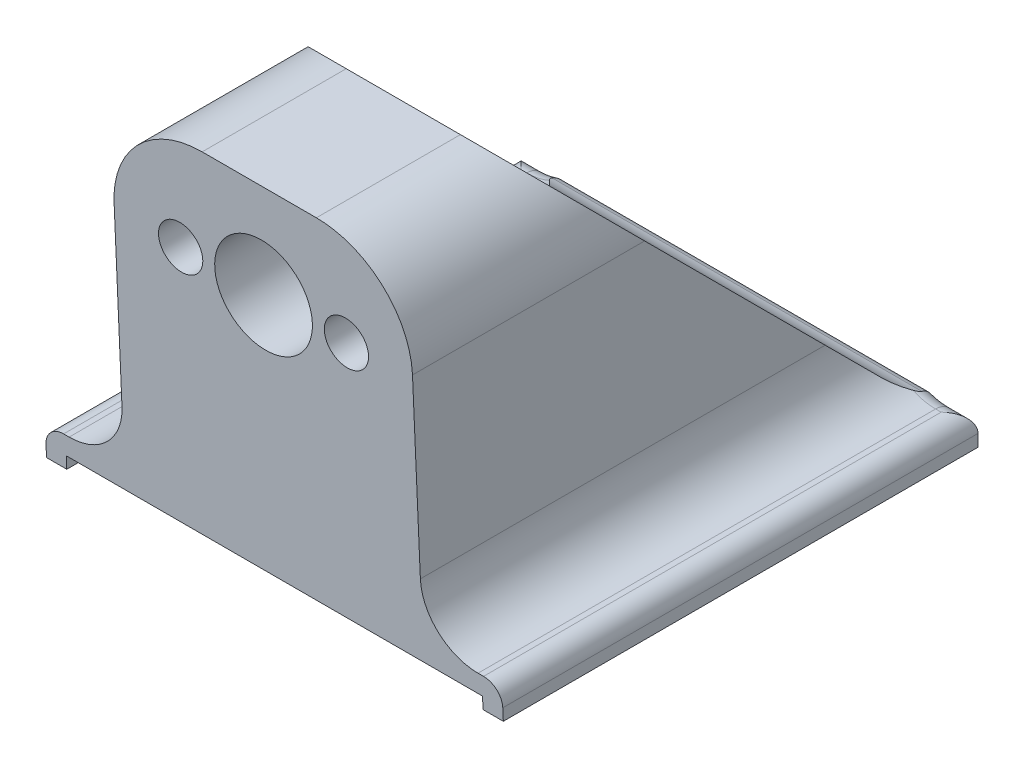
from build123d import *

# Parameters (mm, degrees)
SKETCH1_W             = 24.8
SKETCH1_H             = 25.8
BOSS_EXTRUDE1_DEPTH   = 1
SKETCH3_W             = 16.2
SKETCH3_H             = 7
BOSS_EXTRUDE3_DEPTH   = 17.8
DRAFT2_ANGLE          = 45
TOP_FILLET_R          = 5
SKETCH4_R             = 2.65
HOLE_BOLT_DEPTH       = 4
SKETCH5_R             = 4.5
HOLE_BOLT_CAP_DEPTH   = 20
SKETCH6_R             = 1.2
HOLES_DOWEL_PIN_DEPTH = 2.5
BASE_FILLET_R         = 3
BRIM_DEPTH            = 0.65
INWARD_SLANT_ANGLE    = 2.5
FILLET1_START         = 8.48845
FILLET1_2_DEPTH       = 24.8
FILLET1_3_DEPTH       = 1.3
FILLET1_START_2       = 31.98845
FILLET1_4_DEPTH       = 1.3
FILLET1_START_3       = -20
FILLET1_5_DEPTH       = 28


with BuildPart() as part:
    # Sketch1 → Boss-Extrude1 (new body)
    with BuildSketch(Plane(origin=(0, 0, 0), x_dir=(1, 0, 0), z_dir=(0, 1, 0))):
        with Locations((20.88845, 5.671213532)):
            Rectangle(SKETCH1_W, SKETCH1_H)
    extrude(amount=BOSS_EXTRUDE1_DEPTH)

    # Sketch3 → Boss-Extrude3 (add)
    with BuildSketch(Plane(origin=(0, 1, 0), x_dir=(1, 0, 0), z_dir=(0, 1, 0))):
        with Locations((20.88845, -3.728786468)):
            Rectangle(SKETCH3_W, SKETCH3_H)
    extrude(amount=BOSS_EXTRUDE3_DEPTH)

    # Draft2
    draft2_faces = [part.faces().sort_by_distance(p)[0] for p in [
        (20.88845, 9.9, 0.228786468),
    ]]
    draft(draft2_faces, Plane.ZX.offset(18.8), DRAFT2_ANGLE)

    # top_fillet
    top_fillet_edges = [part.edges().sort_by_distance(p)[0] for p in [
        (12.78845, 18.8, 3.728786468),
        (28.98845, 18.8, 3.728786468),
    ]]
    fillet(top_fillet_edges, radius=TOP_FILLET_R)

    # Sketch4 → hole_bolt (cut)
    with BuildSketch(Plane.XY.offset(7.228786468)):
        with Locations((20.88845, 13.5)):
            Circle(SKETCH4_R)
    extrude(amount=-HOLE_BOLT_DEPTH, mode=Mode.SUBTRACT)

    # Sketch5 → hole_bolt_cap (cut)
    with BuildSketch(Plane.XY.offset(3.228786468)):
        with Locations((20.88845, 13.5)):
            Circle(SKETCH5_R)
    extrude(amount=-HOLE_BOLT_CAP_DEPTH, mode=Mode.SUBTRACT)

    # Sketch6 → holes_dowel_pin (cut)
    with BuildSketch(Plane.XY.offset(7.228786468)):
        with Locations((25.38845, 13.5)):
            Circle(SKETCH6_R)
        with Locations((16.38845, 13.5)):
            Circle(SKETCH6_R)
    extrude(amount=-HOLES_DOWEL_PIN_DEPTH, mode=Mode.SUBTRACT)

    # base_fillet
    # the kernel refuses this fillet: 3 mm, written as the material it adds along each edge
    with BuildSketch(Plane(origin=(12.78845, 1, -25.071213532), x_dir=(-1, 0, 0), z_dir=(0, 0, 1))) as base_fillet_piece_1_section:
        with BuildLine():
            CenterArc((BASE_FILLET_R, -BASE_FILLET_R), BASE_FILLET_R, 90, 90)
            Line((0, -BASE_FILLET_R), (0, 0))
            Line((0, 0), (BASE_FILLET_R, 0))
        make_face()
    base_fillet_piece_1 = extrude(amount=32.3, mode=Mode.PRIVATE)
    base_fillet_piece_1 = split(base_fillet_piece_1, bisect_by=Plane(origin=(12.78845, -2.75, -21.321213532), z_dir=(0, -0.7071067811865488, 0.7071067811865462)), keep=Keep.TOP, mode=Mode.PRIVATE)
    add(base_fillet_piece_1)
    with BuildSketch(Plane(origin=(28.98845, 1, 7.228786468), x_dir=(0, 1, 0), z_dir=(0, 0, -1))) as base_fillet_piece_2_section:
        with BuildLine():
            CenterArc((BASE_FILLET_R, BASE_FILLET_R), BASE_FILLET_R, 180, 90)
            Line((0, BASE_FILLET_R), (0, 0))
            Line((0, 0), (BASE_FILLET_R, 0))
        make_face()
    base_fillet_piece_2 = extrude(amount=32.3, mode=Mode.PRIVATE)
    base_fillet_piece_2 = split(base_fillet_piece_2, bisect_by=Plane(origin=(28.98845, 13.4, -5.171213532), z_dir=(0, -0.7071067811865488, 0.7071067811865462)), keep=Keep.TOP, mode=Mode.PRIVATE)
    add(base_fillet_piece_2)
    with BuildSketch(Plane(origin=(28.98845, 1, -17.571213532), x_dir=(0, 0, -1), z_dir=(-1, 0, 0))) as base_fillet_piece_3:
        with BuildLine():
            CenterArc((1.25335823, -2.989282457), BASE_FILLET_R, 94.844556223, 40.155443777)
            Line((-0.867962113, -0.867962113), (0, 0))
            Line((0, 0), (1, 0))
        make_face()
    extrude(amount=16.2)
    with BuildSketch(Plane(origin=(12.78845, 1, -25.071213532), x_dir=(-1, 0, 0), z_dir=(0, 0, 1))) as base_fillet_piece_4a_section:
        with BuildLine():
            CenterArc((BASE_FILLET_R, -BASE_FILLET_R), BASE_FILLET_R, 90, 90)
            Line((0, -BASE_FILLET_R), (0, 0))
            Line((0, 0), (BASE_FILLET_R, 0))
        make_face()
    base_fillet_piece_4a = extrude(amount=32.3, mode=Mode.PRIVATE)
    base_fillet_piece_4a = split(base_fillet_piece_4a, bisect_by=Plane(origin=(12.78845, -2.75, -21.321213532), z_dir=(0, 0.7071067811865488, -0.7071067811865462)), keep=Keep.TOP, mode=Mode.PRIVATE)
    base_fillet_piece_4a = split(base_fillet_piece_4a, bisect_by=Plane(origin=(12.78845, 1, -18.571213532), z_dir=(0, 0, 1)), keep=Keep.TOP, mode=Mode.PRIVATE)
    with BuildSketch(Plane(origin=(28.98845, 1, -17.571213532), x_dir=(0, 0, -1), z_dir=(-1, 0, 0))) as base_fillet_piece_4b_section:
        with BuildLine():
            CenterArc((1.25335823, -2.989282457), BASE_FILLET_R, 94.844556223, 40.155443777)
            Line((-0.867962113, -0.867962113), (0, 0))
            Line((0, 0), (1, 0))
        make_face()
    base_fillet_piece_4b = extrude(amount=19.268709481, mode=Mode.PRIVATE)
    base_fillet_piece_4b = split(base_fillet_piece_4b, bisect_by=Plane(origin=(12.78845, 1, -17.571213532), z_dir=(-1, 0, 0)), keep=Keep.TOP, mode=Mode.PRIVATE)
    base_fillet_piece_4 = base_fillet_piece_4a & base_fillet_piece_4b
    add(base_fillet_piece_4)
    with BuildSketch(Plane(origin=(28.98845, 1, 7.228786468), x_dir=(0, 1, 0), z_dir=(0, 0, -1))) as base_fillet_piece_5a_section:
        with BuildLine():
            CenterArc((BASE_FILLET_R, BASE_FILLET_R), BASE_FILLET_R, 180, 90)
            Line((0, BASE_FILLET_R), (0, 0))
            Line((0, 0), (BASE_FILLET_R, 0))
        make_face()
    base_fillet_piece_5a = extrude(amount=32.3, mode=Mode.PRIVATE)
    base_fillet_piece_5a = split(base_fillet_piece_5a, bisect_by=Plane(origin=(28.98845, 13.4, -5.171213532), z_dir=(0, 0.7071067811865488, -0.7071067811865462)), keep=Keep.TOP, mode=Mode.PRIVATE)
    base_fillet_piece_5a = split(base_fillet_piece_5a, bisect_by=Plane(origin=(28.98845, 1, -18.571213532), z_dir=(0, 0, 1)), keep=Keep.TOP, mode=Mode.PRIVATE)
    with BuildSketch(Plane(origin=(32.057159481, 1, -17.571213532), x_dir=(0, 0, -1), z_dir=(-1, 0, 0))) as base_fillet_piece_5b_section:
        with BuildLine():
            CenterArc((1.25335823, -2.989282457), BASE_FILLET_R, 94.844556223, 40.155443777)
            Line((-0.867962113, -0.867962113), (0, 0))
            Line((0, 0), (1, 0))
        make_face()
    base_fillet_piece_5b = extrude(amount=19.268709481, mode=Mode.PRIVATE)
    base_fillet_piece_5b = split(base_fillet_piece_5b, bisect_by=Plane(origin=(28.98845, 1, -17.571213532), z_dir=(1, 0, 0)), keep=Keep.TOP, mode=Mode.PRIVATE)
    base_fillet_piece_5 = base_fillet_piece_5a & base_fillet_piece_5b
    add(base_fillet_piece_5)

    # Sketch8 → brim (add)
    with BuildSketch(Plane.XZ):
        Polygon((8.48845, 7.228786468), (9.58845, 7.228786468), (9.58845, -17.471213532), (32.18845, -17.471213532), (32.18845, 7.228786468), (33.28845, 7.228786468), (33.28845, -18.571213532), (8.48845, -18.571213532), align=None)
    extrude(amount=BRIM_DEPTH)

    # inward_slant
    inward_slant_faces = [part.faces().sort_by_distance(p)[0] for p in [
        (20.88845, 8.182651501, 7.228786468),
    ]]
    draft(inward_slant_faces, Plane(origin=(0, 0, 0), x_dir=(0, 0, -1), z_dir=(0, -1, 0)), INWARD_SLANT_ANGLE)

    # Fillet1: read off the stored shape, not the designer's step
    # Fillet1 outline → Fillet1 (revolve, cut)
    with BuildSketch(Plane(origin=(9.78845, 4, 0), x_dir=(1, 0, 0), z_dir=(0, -1, 0))):
        with BuildLine():
            ThreePointArc((4, -18.571213532), (3.292893219, -18.278320313), (3, -17.571213532))
            Line((3, -17.571213532), (3, -18.571213532))
            Line((3, -18.571213532), (4, -18.571213532))
        make_face()
    revolve(axis=Axis((9.78845, 4, 0), (0, 0, 1)), mode=Mode.SUBTRACT)

    # Fillet1 2 outline → Fillet1 2 (cut)
    with BuildSketch(Plane.YZ.offset(FILLET1_START)):
        with BuildLine():
            Line((1, -18.254186707), (1, -18.158633642))
            ThreePointArc((1, -18.158633642), (0.644909369, -18.462117598), (0.19071784, -18.571213532))
            Line((0.19071784, -18.571213532), (1, -18.571213532))
            Line((1, -18.571213532), (1, -18.254186707))
        make_face()
        with BuildLine():
            ThreePointArc((1.140358994, -17.884553089), (1.080792468, -18.027028359), (1, -18.158633642))
            Line((1, -18.158633642), (1, -18.254186707))
            Line((1, -18.254186707), (0.999995093, -18.571271439))
            ThreePointArc((0.999995093, -18.571271439), (1.050052637, -18.223798874), (1.140358994, -17.884553089))
        make_face()
    extrude(amount=FILLET1_2_DEPTH, mode=Mode.SUBTRACT)

    # Fillet1 3 outline → Fillet1 3 (cut)
    with BuildSketch(Plane.YZ.offset(FILLET1_START)):
        with BuildLine():
            Line((1, -18.158633642), (1, -17.571213532))
            ThreePointArc((1, -17.571213532), (0.707106781, -18.278320313), (0, -18.571213532))
            Line((0, -18.571213532), (0.19071784, -18.571213532))
            ThreePointArc((0.19071784, -18.571213532), (0.644909369, -18.462117598), (1, -18.158633642))
        make_face()
    extrude(amount=FILLET1_3_DEPTH, mode=Mode.SUBTRACT)

    # Fillet1 4 outline → Fillet1 4 (cut)
    with BuildSketch(Plane.YZ.offset(FILLET1_START_2)):
        with BuildLine():
            Line((1, -18.158633642), (1, -17.571213532))
            ThreePointArc((1, -17.571213532), (0.707106781, -18.278320313), (0, -18.571213532))
            Line((0, -18.571213532), (0.19071784, -18.571213532))
            ThreePointArc((0.19071784, -18.571213532), (0.644909369, -18.462117598), (1, -18.158633642))
        make_face()
    extrude(amount=FILLET1_4_DEPTH, mode=Mode.SUBTRACT)

    # Fillet1 5 outline → Fillet1 5 (cut)
    with BuildSketch(Plane.XY.offset(FILLET1_START_3)):
        with BuildLine():
            ThreePointArc((8.48845, 0), (8.781343219, 0.707106781), (9.48845, 1))
            Line((9.48845, 1), (8.48845, 1))
            Line((8.48845, 1), (8.48845, 0))
        make_face()
        with BuildLine():
            Line((33.28845, 1), (32.28845, 1))
            ThreePointArc((32.28845, 1), (32.995556781, 0.707106781), (33.28845, 0))
            Line((33.28845, 0), (33.28845, 1))
        make_face()
    extrude(amount=FILLET1_5_DEPTH, mode=Mode.SUBTRACT)

    # Fillet1 6 outline → Fillet1 6 (revolve, cut)
    with BuildSketch(Plane(origin=(31.98845, 4, 0), x_dir=(1, 0, 0), z_dir=(0, -1, 0))):
        with BuildLine():
            ThreePointArc((4, -18.571213532), (3.292893219, -18.278320313), (3, -17.571213532))
            Line((3, -17.571213532), (3, -18.571213532))
            Line((3, -18.571213532), (4, -18.571213532))
        make_face()
    revolve(axis=Axis((31.98845, 4, 0), (0, 0, 1)), mode=Mode.SUBTRACT)


solid = part.part
